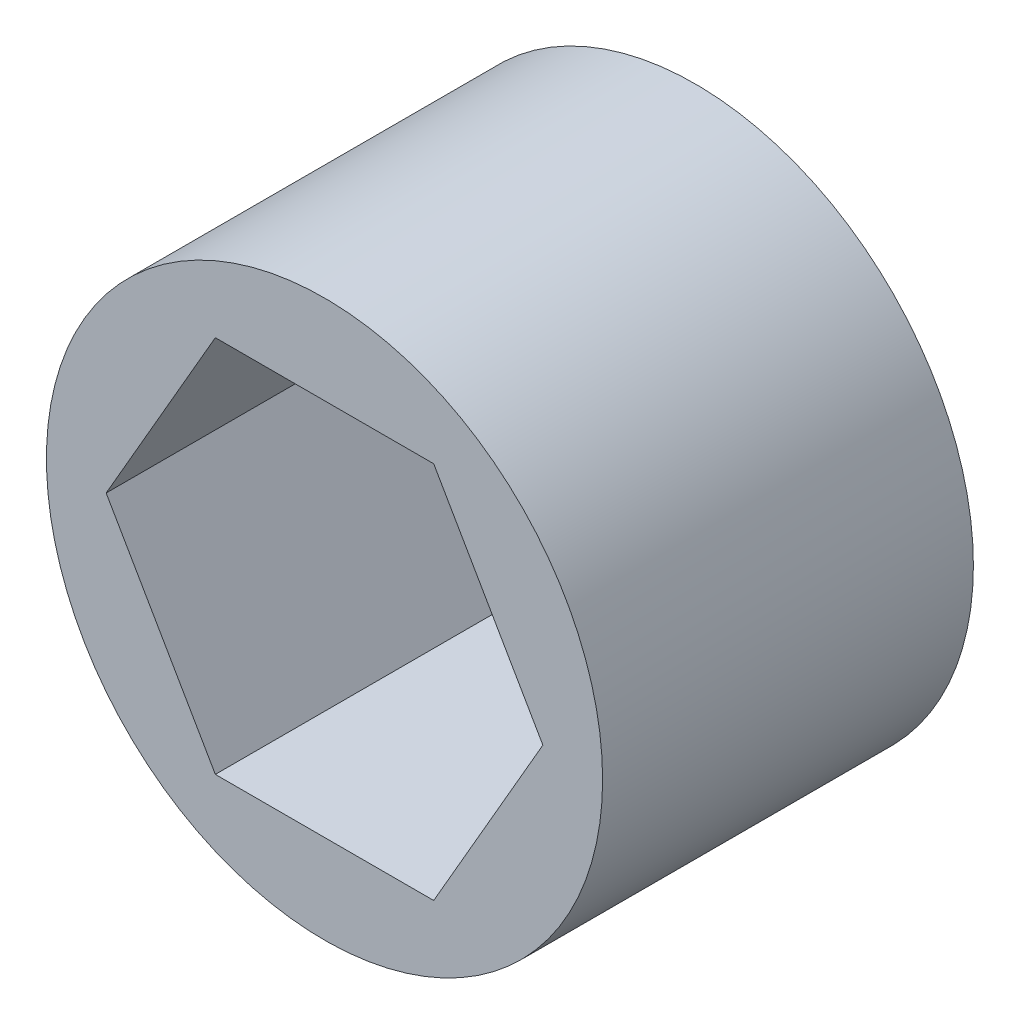
from build123d import *

# Parameters (mm, degrees)
SKETCH1_R           = 9.525
BOSS_EXTRUDE1_DEPTH = 6.35


with BuildPart() as part:
    # Sketch1 → Boss-Extrude1 (new, symmetric)
    with BuildSketch(Plane.XY):
        Circle(SKETCH1_R)
        Polygon((7.478995387, 0), (3.739497694, 6.477), (-3.739497694, 6.477), (-7.478995387, 0), (-3.739497694, -6.477), (3.739497694, -6.477), align=None, mode=Mode.SUBTRACT)
    extrude(amount=BOSS_EXTRUDE1_DEPTH, both=True)


solid = part.part
